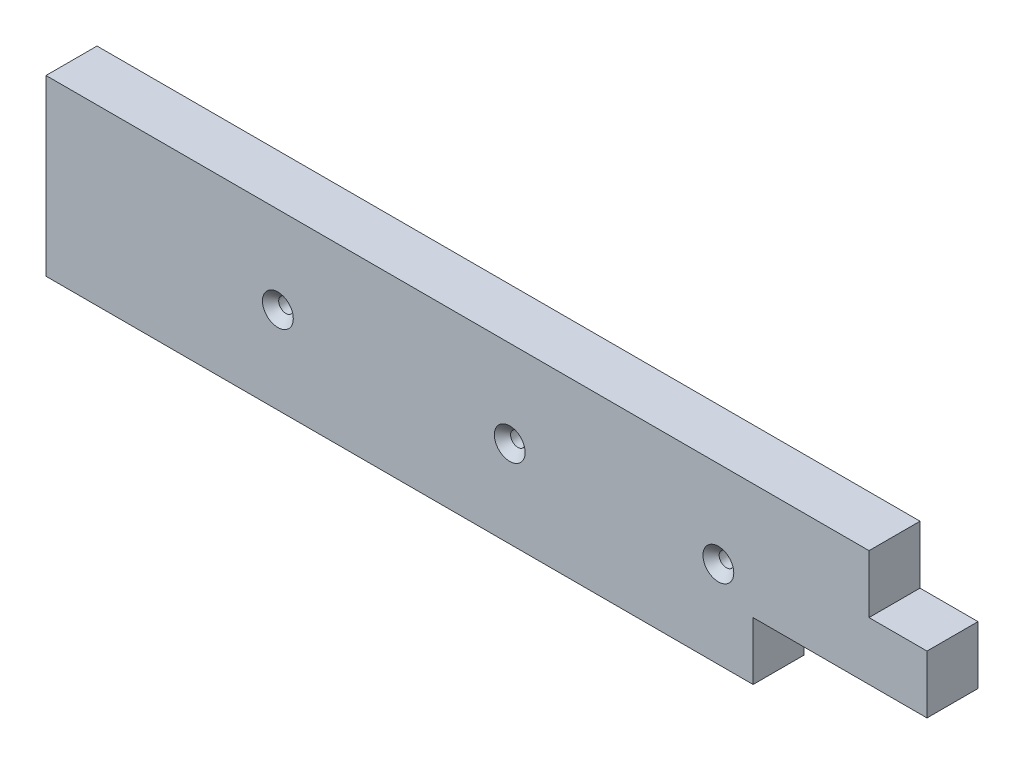
from build123d import *

# Parameters (mm, degrees)
SKETCH1_W                                            = 386.012712352
SKETCH1_H                                            = 22.352
BOSS_EXTRUDE1_DEPTH                                  = 38.1
CSK_FOR_M6_HEX_SOCKET_COUNTERSUNK_HEAD_S_D           = 6.4
CSK_FOR_M6_HEX_SOCKET_COUNTERSUNK_HEAD_S_CSINK_D     = 13.5
CSK_FOR_M6_HEX_SOCKET_COUNTERSUNK_HEAD_S_CSINK_ANGLE = 90
CSK_FOR_M6_HEX_SOCKET_COUNTERSUNK_HE_2_D             = 6.4
CSK_FOR_M6_HEX_SOCKET_COUNTERSUNK_HE_2_CSINK_D       = 13.5
CSK_FOR_M6_HEX_SOCKET_COUNTERSUNK_HE_2_CSINK_ANGLE   = 90
CSK_FOR_M6_HEX_SOCKET_COUNTERSUNK_HE_3_D             = 6.4
CSK_FOR_M6_HEX_SOCKET_COUNTERSUNK_HE_3_CSINK_D       = 13.5
CSK_FOR_M6_HEX_SOCKET_COUNTERSUNK_HE_3_CSINK_ANGLE   = 90
SKETCH3_W                                            = 25.4
SKETCH3_H                                            = 25.4
SKETCH3_W_2                                          = 76.186487456
CUT_EXTRUDE1_DEPTH                                   = 198.996655094


with BuildPart() as part:
    # Sketch1 → Boss-Extrude1 (new, symmetric)
    with BuildSketch(Plane(origin=(0, 0, 0), x_dir=(1, 0, 0), z_dir=(0, 1, 0))):
        Rectangle(SKETCH1_W, SKETCH1_H)
    extrude(amount=BOSS_EXTRUDE1_DEPTH, both=True)

    # CSK for M6 Hex Socket Countersunk Head S (through all)
    with Locations(Plane.XY.offset(11.176)):
        with Locations((-91.406356176, 0)):
            CounterSinkHole(CSK_FOR_M6_HEX_SOCKET_COUNTERSUNK_HEAD_S_D / 2, CSK_FOR_M6_HEX_SOCKET_COUNTERSUNK_HEAD_S_CSINK_D / 2, counter_sink_angle=CSK_FOR_M6_HEX_SOCKET_COUNTERSUNK_HEAD_S_CSINK_ANGLE)

    # CSK for M6 Hex Socket Countersunk He 2 (through all)
    with Locations(Plane.XY.offset(11.176)):
        with Locations((10.193643824, 0)):
            CounterSinkHole(CSK_FOR_M6_HEX_SOCKET_COUNTERSUNK_HE_2_D / 2, CSK_FOR_M6_HEX_SOCKET_COUNTERSUNK_HE_2_CSINK_D / 2, counter_sink_angle=CSK_FOR_M6_HEX_SOCKET_COUNTERSUNK_HE_2_CSINK_ANGLE)

    # CSK for M6 Hex Socket Countersunk He 3 (through all)
    with Locations(Plane.XY.offset(11.176)):
        with Locations((101.6, 0)):
            CounterSinkHole(CSK_FOR_M6_HEX_SOCKET_COUNTERSUNK_HE_3_D / 2, CSK_FOR_M6_HEX_SOCKET_COUNTERSUNK_HE_3_CSINK_D / 2, counter_sink_angle=CSK_FOR_M6_HEX_SOCKET_COUNTERSUNK_HE_3_CSINK_ANGLE)

    # Sketch3 → Cut-Extrude1 (cut, through all)
    with BuildSketch(Plane.XY.offset(11.176)):
        with Locations((180.306356176, 25.4)):
            Rectangle(SKETCH3_W, SKETCH3_H)
        with Locations((154.913112448, -25.4)):
            Rectangle(SKETCH3_W_2, SKETCH3_H)
    extrude(amount=-CUT_EXTRUDE1_DEPTH, mode=Mode.SUBTRACT)


solid = part.part
